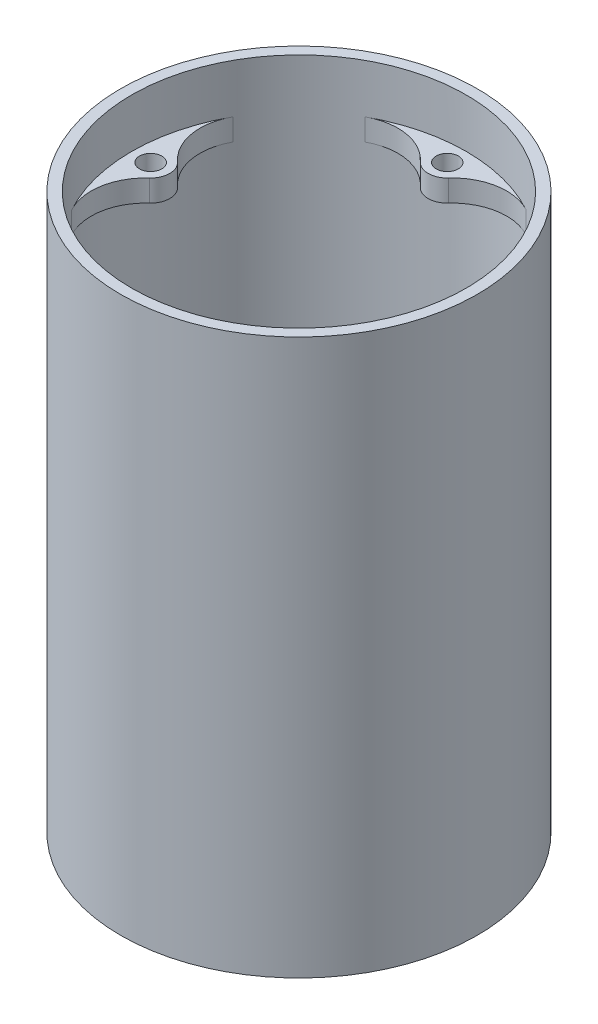
from build123d import *

# Parameters (mm, degrees)
SKETCH1_R           = 32.75
SKETCH1_R_2         = 30.75
BOSS_EXTRUDE1_DEPTH = 102
SKETCH3_R           = 2.05
BOSS_EXTRUDE2_DEPTH = 4
FILLET1_R           = 10


with BuildPart() as part:
    # Sketch1 → Boss-Extrude1 (new body)
    with BuildSketch(Plane(origin=(0, 0, 0), x_dir=(1, 0, 0), z_dir=(0, 1, 0))):
        with Locations(Location((0, 0, 0), (0, 0, 270))):
            Circle(SKETCH1_R)
        with Locations(Location((0, 0, 0), (0, 0, 270))):
            Circle(SKETCH1_R_2, mode=Mode.SUBTRACT)
    extrude(amount=BOSS_EXTRUDE1_DEPTH)

    # Sketch3 → Boss-Extrude2 (add)
    # profile 1 of 4: a face of its own
    with BuildSketch(Plane(origin=(0, 93, 0), x_dir=(1, 0, 0), z_dir=(0, 1, 0))):
        with BuildLine():
            Line((-3.5, 27.25), (-3.5, 30.801785663))
            ThreePointArc((-3.5, 30.801785663), (0, 31), (3.5, 30.801785663))
            Line((3.5, 30.801785663), (3.5, 27.25))
            ThreePointArc((3.5, 27.25), (0, 23.75), (-3.5, 27.25))
        make_face()
        with Locations(Location((0, 27.25, 0), (0, 0, 270))):
            Circle(SKETCH3_R, mode=Mode.SUBTRACT)
    # profile 2 of 4: a face of its own
    with BuildSketch(Plane(origin=(0, 93, 0), x_dir=(1, 0, 0), z_dir=(0, 1, 0))):
        with BuildLine():
            Line((27.25, -3.5), (30.801785663, -3.5))
            ThreePointArc((30.801785663, -3.5), (31, 0), (30.801785663, 3.5))
            Line((30.801785663, 3.5), (27.25, 3.5))
            ThreePointArc((27.25, 3.5), (23.75, 0), (27.25, -3.5))
        make_face()
        with Locations(Location((27.25, 0, 0), (0, 0, 270))):
            Circle(SKETCH3_R, mode=Mode.SUBTRACT)
    # profile 3 of 4: a face of its own
    with BuildSketch(Plane(origin=(0, 93, 0), x_dir=(1, 0, 0), z_dir=(0, 1, 0))):
        with BuildLine():
            Line((-3.5, -27.25), (-3.5, -30.801785663))
            ThreePointArc((-3.5, -30.801785663), (0, -31), (3.5, -30.801785663))
            Line((3.5, -30.801785663), (3.5, -27.25))
            ThreePointArc((3.5, -27.25), (0, -23.75), (-3.5, -27.25))
        make_face()
        with Locations(Location((0, -27.25, 0), (0, 0, 270))):
            Circle(SKETCH3_R, mode=Mode.SUBTRACT)
    # profile 4 of 4: a face of its own
    with BuildSketch(Plane(origin=(0, 93, 0), x_dir=(1, 0, 0), z_dir=(0, 1, 0))):
        with BuildLine():
            Line((-27.25, 3.5), (-30.801785663, 3.5))
            ThreePointArc((-30.801785663, 3.5), (-31, 0), (-30.801785663, -3.5))
            Line((-30.801785663, -3.5), (-27.25, -3.5))
            ThreePointArc((-27.25, -3.5), (-23.75, 0), (-27.25, 3.5))
        make_face()
        with Locations(Location((-27.25, 0, 0), (0, 0, 270))):
            Circle(SKETCH3_R, mode=Mode.SUBTRACT)
    extrude(amount=-BOSS_EXTRUDE2_DEPTH)

    # Fillet1
    # the kernel refuses this fillet: 10 mm, written as the material it adds along each edge
    with BuildSketch(Plane(origin=(30.550163666, 93, 3.5), x_dir=(-0.30360135292633833, 0, 0.9527991490872024), z_dir=(0, -1, 0)), Plane(origin=(-3.5, 93, 30.550163666), x_dir=(-0.9527991490872014, 0, -0.30360135292634133), z_dir=(0, -1, 0)), Plane(origin=(-30.550163666, 93, -3.5), x_dir=(0.3036013529263449, 0, -0.9527991490872003), z_dir=(0, -1, 0)), Plane(origin=(3.5, 93, -30.550163666), x_dir=(0.9527991490872035, 0, 0.30360135292633456), z_dir=(0, -1, 0))) as fillet1_piece_1:
        with BuildLine():
            CenterArc((9.948751576, 9.811634042), FILLET1_R, 204.529281699, 76.609121242)
            Line((0.851259395, 5.660051691), (-0.058489823, 5.244893456))
            ThreePointArc((-0.058489823, 5.244893456), (0.049135005, 3.447994485), (-0.952799149, 0.303601353))
            Line((-0.952799149, 0.303601353), (-0.193179642, -0.981163404))
            ThreePointArc((-0.193179642, -0.981163404), (5.940273999, -1.57922532), (12.073727641, -0.981163404))
            Line((12.073727641, -0.981163404), (11.880547998, 0))
        make_face()
    extrude(amount=4)
    with BuildSketch(Plane(origin=(30.550163666, 93, -3.5), x_dir=(-0.3036013529263308, 0, -0.9527991490872049), z_dir=(0, -1, 0)), Plane(origin=(3.5, 93, 30.550163666), x_dir=(0.9527991490872056, 0, -0.3036013529263281), z_dir=(0, -1, 0)), Plane(origin=(-30.550163666, 93, 3.5), x_dir=(0.30360135292632445, 0, 0.9527991490872069), z_dir=(0, -1, 0)), Plane(origin=(-3.5, 93, -30.550163666), x_dir=(-0.9527991490872035, 0, 0.30360135292633467), z_dir=(0, -1, 0))) as fillet1_piece_2:
        with BuildLine():
            CenterArc((9.948751576, -9.811634042), FILLET1_R, 78.861597059, 76.609121242)
            Line((0.851259395, -5.660051691), (-0.058489823, -5.244893456))
            ThreePointArc((-0.058489823, -5.244893456), (0.049135005, -3.447994485), (-0.952799149, -0.303601353))
            Line((-0.952799149, -0.303601353), (-0.193179642, 0.981163404))
            ThreePointArc((-0.193179642, 0.981163404), (5.940273999, 1.57922532), (12.073727641, 0.981163404))
            Line((12.073727641, 0.981163404), (11.880547998, 0))
        make_face()
    extrude(amount=4)


solid = part.part
